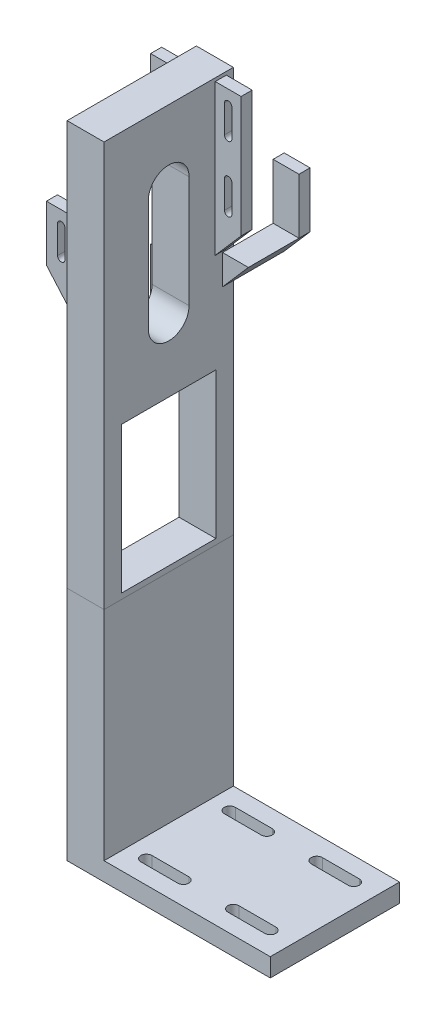
from build123d import *

# Parameters (mm, degrees)
SKETCH1_W               = 20
SKETCH1_H               = 70
SKETCH1_W_2             = 90
BOSS_EXTRUDE1_DEPTH     = 10
SKETCH1_3_W             = 20
SKETCH1_3_H             = 70
BOSS_EXTRUDE2_DEPTH     = 212
BOSS_EXTRUDE3_START     = -20
SKETCH2_W               = 6
SKETCH2_H               = 30
BOSS_EXTRUDE3_DEPTH     = 15
BOSS_EXTRUDE3_2_DEPTH   = 15
BOSS_EXTRUDE3_3_DEPTH   = 15
CUT_EXTRUDE3_DEPTH      = 353.433372815
CUT_EXTRUDE3_DEPTH_BACK = 127.2
SKETCH7_W               = 20
SKETCH7_H               = 70
BOSS_EXTRUDE4_DEPTH     = 135
SKETCH12_W              = 15
SKETCH12_H              = 6
BOSS_EXTRUDE6_DEPTH     = 24.325180813
BOSS_EXTRUDE7_START     = -31.2
BOSS_EXTRUDE7_DEPTH     = 6
BOSS_EXTRUDE8_START     = -31.2
BOSS_EXTRUDE8_DEPTH     = 6
SKETCH3_W               = 51.18180782
SKETCH3_H               = 79.106689165
CUT_EXTRUDE1_DEPTH      = 60
SKETCH17_W              = 6
SKETCH17_H              = 30
BOSS_EXTRUDE9_DEPTH     = 14
CUT_EXTRUDE4_DEPTH      = 14
BOSS_EXTRUDE11_START    = -62.536720157
BOSS_EXTRUDE11_DEPTH    = 33.403488582
SKETCH23_W              = 14
SKETCH23_H              = 6
BOSS_EXTRUDE12_DEPTH    = 28.275172031
SKETCH24_W              = 14
SKETCH24_H              = 6
BOSS_EXTRUDE13_DEPTH    = 5.382525931


with BuildPart() as part:
    # Sketch1 → Boss-Extrude1 (new body)
    # profile 1 of 2: a face of its own
    with BuildSketch(Plane(origin=(0, 0, 0), x_dir=(1, 0, 0), z_dir=(0, 1, 0))):
        with Locations((-33.658940342, 0)):
            Rectangle(SKETCH1_W, SKETCH1_H)
    # profile 2 of 2: a face of its own
    with BuildSketch(Plane(origin=(0, 0, 0), x_dir=(1, 0, 0), z_dir=(0, 1, 0))):
        with Locations((21.341059658, 0)):
            Rectangle(SKETCH1_W_2, SKETCH1_H)
        with BuildLine():
            Line((6.841826819, -25.578170589), (-13.158173181, -25.578170589))
            ThreePointArc((-13.158173181, -25.578170589), (-16.158173181, -22.578170589), (-13.158173181, -19.578170589))
            Line((-13.158173181, -19.578170589), (6.841826819, -19.578170589))
            ThreePointArc((6.841826819, -19.578170589), (9.841826819, -22.578170589), (6.841826819, -25.578170589))
        make_face(mode=Mode.SUBTRACT)
        with BuildLine():
            ThreePointArc((53.940052041, -19.578170589), (56.940052041, -22.578170589), (53.940052041, -25.578170589))
            Line((53.940052041, -25.578170589), (33.940052041, -25.578170589))
            ThreePointArc((33.940052041, -25.578170589), (30.940052041, -22.578170589), (33.940052041, -19.578170589))
            Line((33.940052041, -19.578170589), (53.940052041, -19.578170589))
        make_face(mode=Mode.SUBTRACT)
        with BuildLine():
            ThreePointArc((-13.158173181, 19.578170589), (-16.158173181, 22.578170589), (-13.158173181, 25.578170589))
            Line((-13.158173181, 25.578170589), (6.841826819, 25.578170589))
            ThreePointArc((6.841826819, 25.578170589), (9.841826819, 22.578170589), (6.841826819, 19.578170589))
            Line((6.841826819, 19.578170589), (-13.158173181, 19.578170589))
        make_face(mode=Mode.SUBTRACT)
        with BuildLine():
            Line((33.940052041, 25.578170589), (53.940052041, 25.578170589))
            ThreePointArc((53.940052041, 25.578170589), (56.940052041, 22.578170589), (53.940052041, 19.578170589))
            Line((53.940052041, 19.578170589), (33.940052041, 19.578170589))
            ThreePointArc((33.940052041, 19.578170589), (30.940052041, 22.578170589), (33.940052041, 25.578170589))
        make_face(mode=Mode.SUBTRACT)
    extrude(amount=BOSS_EXTRUDE1_DEPTH)

    # Sketch1<3> → Boss-Extrude2 (add)
    with BuildSketch(Plane(origin=(0, 0, 0), x_dir=(1, 0, 0), z_dir=(0, 1, 0))):
        with Locations((-33.658940342, 0)):
            Rectangle(SKETCH1_3_W, SKETCH1_3_H)
    extrude(amount=BOSS_EXTRUDE2_DEPTH)


with BuildPart() as body_2:
    # Sketch2 → Boss-Extrude3 (new body)
    with BuildSketch(Plane(origin=(-23.658940342, 0, 0), x_dir=(0, 0, -1), z_dir=(1, 0, 0)).offset(BOSS_EXTRUDE3_START)):
        with Locations((-28.2, 284.836255525)):
            Rectangle(SKETCH2_W, SKETCH2_H)
    extrude(amount=-BOSS_EXTRUDE3_DEPTH)


with BuildPart() as body_3:
    # Sketch2 → Boss-Extrude3 2 (new body)
    with BuildSketch(Plane(origin=(-23.658940342, 0, 0), x_dir=(0, 0, -1), z_dir=(1, 0, 0)).offset(BOSS_EXTRUDE3_START)):
        with Locations((28.2, 236.477808494)):
            Rectangle(SKETCH2_W, SKETCH2_H)
    extrude(amount=-BOSS_EXTRUDE3_2_DEPTH)


with BuildPart() as body_4:
    # Sketch2 → Boss-Extrude3 3 (new body)
    with BuildSketch(Plane(origin=(-23.658940342, 0, 0), x_dir=(0, 0, -1), z_dir=(1, 0, 0)).offset(BOSS_EXTRUDE3_START)):
        with Locations((28.2, 325.85789719)):
            Rectangle(SKETCH2_W, SKETCH2_H)
    extrude(amount=-BOSS_EXTRUDE3_3_DEPTH)


with BuildPart() as cut_extrude3_tool:
    # Sketch5 → Cut-Extrude3 (new, two sides: drawn at the far end of the back side and taken through both)
    with BuildSketch(Plane.XY.offset(-25.2).offset(-CUT_EXTRUDE3_DEPTH_BACK)):
        with BuildLine():
            Line((-48.658940342, 292.336255525), (-48.658940342, 277.336255525))
            ThreePointArc((-48.658940342, 277.336255525), (-50.658940342, 275.336255525), (-52.658940342, 277.336255525))
            Line((-52.658940342, 277.336255525), (-52.658940342, 292.336255525))
            ThreePointArc((-52.658940342, 292.336255525), (-50.658940342, 294.336255525), (-48.658940342, 292.336255525))
        make_face()
        with BuildLine():
            Line((-48.658940342, 243.977808494), (-48.658940342, 228.977808494))
            ThreePointArc((-48.658940342, 228.977808494), (-50.658940342, 226.977808494), (-52.658940342, 228.977808494))
            Line((-52.658940342, 228.977808494), (-52.658940342, 243.977808494))
            ThreePointArc((-52.658940342, 243.977808494), (-50.658940342, 245.977808494), (-48.658940342, 243.977808494))
        make_face()
        with BuildLine():
            Line((-48.658940342, 333.35789719), (-48.658940342, 318.35789719))
            ThreePointArc((-48.658940342, 318.35789719), (-50.658940342, 316.35789719), (-52.658940342, 318.35789719))
            Line((-52.658940342, 318.35789719), (-52.658940342, 333.35789719))
            ThreePointArc((-52.658940342, 333.35789719), (-50.658940342, 335.35789719), (-48.658940342, 333.35789719))
        make_face()
    extrude(amount=CUT_EXTRUDE3_DEPTH + CUT_EXTRUDE3_DEPTH_BACK)


with BuildPart() as body_2_1:
    add(body_2.part)

    # Cut-Extrude3: cut by cut_extrude3_tool
    add(cut_extrude3_tool.part, mode=Mode.SUBTRACT)



with BuildPart() as body_3_1:
    add(body_3.part)

    # Cut-Extrude3: cut by cut_extrude3_tool
    add(cut_extrude3_tool.part, mode=Mode.SUBTRACT)


with BuildPart() as body_4_1:
    add(body_4.part)

    # Cut-Extrude3: cut by cut_extrude3_tool
    add(cut_extrude3_tool.part, mode=Mode.SUBTRACT)


with BuildPart() as body_2_2:
    add(body_2_1.part)

    add(body_4_1.part)  # Boss-Extrude4 merges body 4

    add(part.part)  # Boss-Extrude4 merges part
    # Sketch7 → Boss-Extrude4 (add)
    with BuildSketch(Plane(origin=(0, 212, 0), x_dir=(1, 0, 0), z_dir=(0, 1, 0))):
        with Locations((-33.658940342, 0)):
            Rectangle(SKETCH7_W, SKETCH7_H)
    extrude(amount=BOSS_EXTRUDE4_DEPTH)

    # Sketch12 → Boss-Extrude6 (add, along a direction that is not the sketch's normal)
    with BuildSketch(Plane.XZ.offset(-269.836255525)):
        with Locations((-51.158940342, 28.2)):
            Rectangle(SKETCH12_W, SKETCH12_H)
    extrude(amount=BOSS_EXTRUDE6_DEPTH, dir=(0.6560590289905114, -0.7547095802227685, 0))

    # Boss-Extrude7: read off the stored shape, not the designer's step
    # Boss-Extrude7 outline → Boss-Extrude7 (add)
    with BuildSketch(Plane.XY.offset(BOSS_EXTRUDE7_START)):
        Polygon((-58.658940342, 310.85789719), (-43.658940342, 293.602371082), (-43.658940342, 310.85789719), align=None)
    extrude(amount=BOSS_EXTRUDE7_DEPTH)


    add(body_3_1.part)  # Boss-Extrude8 merges body 3
    # Boss-Extrude8: read off the stored shape, not the designer's step
    # Boss-Extrude8 outline → Boss-Extrude8 (add)
    with BuildSketch(Plane.XY.offset(BOSS_EXTRUDE8_START)):
        Polygon((-58.658940342, 221.477808494), (-43.658940342, 204.222282386), (-43.658940342, 221.477808494), align=None)
    extrude(amount=BOSS_EXTRUDE8_DEPTH)

    # Sketch3 → Cut-Extrude1 (cut)
    with BuildSketch(Plane(origin=(-23.658940342, 0, 0), x_dir=(0, 0, -1), z_dir=(1, 0, 0))):
        with Locations((0, 170.315397104)):
            Rectangle(SKETCH3_W, SKETCH3_H)
        with BuildLine():
            Line((11.025757264, 307.676468372), (11.025757264, 247.23954324))
            ThreePointArc((11.025757264, 247.23954324), (0, 236.213785975), (-11.025757264, 247.23954324))
            Line((-11.025757264, 247.23954324), (-11.025757264, 307.676468372))
            ThreePointArc((-11.025757264, 307.676468372), (0, 318.702225636), (11.025757264, 307.676468372))
        make_face()
    extrude(amount=-CUT_EXTRUDE1_DEPTH, mode=Mode.SUBTRACT)

    # Sketch17 → Boss-Extrude9 (add)
    with BuildSketch(Plane(origin=(-23.658940342, 0, 0), x_dir=(0, 0, -1), z_dir=(1, 0, 0))):
        with Locations((28.2, 330.230671493)):
            Rectangle(SKETCH17_W, SKETCH17_H)
        with Locations((28.2, 294.848145562)):
            Rectangle(SKETCH17_W, SKETCH17_H)
        with Locations((59.536720157, 278.109746531)):
            Rectangle(SKETCH17_W, SKETCH17_H)
    extrude(amount=BOSS_EXTRUDE9_DEPTH)


with BuildPart() as boss_extrude9_piece_1:
    # of the separate pieces the step leaves, piece 1, a body of its own (boss_extrude9_pieces)
    add(body_2_2.part.solids().sort_by_distance((-43.658940342, 0, -35))[0])

    # Sketch18 → Cut-Extrude4 (cut)
    with BuildSketch(Plane(origin=(0, 0, -31.2), x_dir=(-1, 0, 0), z_dir=(0, 0, -1))):
        with BuildLine():
            Line((14.658940342, 302.348145562), (14.658940342, 287.348145562))
            ThreePointArc((14.658940342, 287.348145562), (16.658940342, 285.348145562), (18.658940342, 287.348145562))
            Line((18.658940342, 287.348145562), (18.658940342, 302.348145562))
            ThreePointArc((18.658940342, 302.348145562), (16.658940342, 304.348145562), (14.658940342, 302.348145562))
        make_face()
        with BuildLine():
            ThreePointArc((18.658940342, 337.730671493), (16.658940342, 339.730671493), (14.658940342, 337.730671493))
            Line((14.658940342, 337.730671493), (14.658940342, 322.730671493))
            ThreePointArc((14.658940342, 322.730671493), (16.658940342, 320.730671493), (18.658940342, 322.730671493))
            Line((18.658940342, 322.730671493), (18.658940342, 337.730671493))
        make_face()
    extrude(amount=-CUT_EXTRUDE4_DEPTH, mode=Mode.SUBTRACT)


with BuildPart() as boss_extrude9_piece_2:
    # of the separate pieces the step leaves, piece 2, a body of its own (boss_extrude9_pieces)
    add(body_2_2.part.solids().sort_by_distance((-23.658940342, 293.109746531, -56.536720157))[0])


with BuildPart() as body_3_2:
    # Intersect1: read off the stored shape, not the designer's step
    # Intersect1: the piece on the far side of the plane
    add(boss_extrude9_piece_1.part)
    split(bisect_by=Plane(origin=(0, 127.762052521, 0), x_dir=(1, 0, 0), z_dir=(0, 1, 0)), keep=Keep.BOTTOM)


with BuildPart() as boss_extrude9_piece_1_1:
    add(boss_extrude9_piece_1.part)

    # Intersect1
    split(bisect_by=Plane(origin=(0, 127.762052521, 0), x_dir=(1, 0, 0), z_dir=(0, 1, 0)), keep=Keep.TOP)

    # Boss-Extrude11: read off the stored shape, not the designer's step
    # Boss-Extrude11 outline → Boss-Extrude11 (add)
    with BuildSketch(Plane.XY.offset(BOSS_EXTRUDE11_START)):
        Polygon((-9.658940342, 263.109746531), (-23.658940342, 263.109746531), (-23.658940342, 247.00458883), align=None)
    extrude(amount=BOSS_EXTRUDE11_DEPTH)

    # Sketch23 → Boss-Extrude12 (add, along a direction that is not the sketch's normal)
    with BuildSketch(Plane.XZ.offset(-279.848145562)):
        with Locations((-16.658940342, -28.2)):
            Rectangle(SKETCH23_W, SKETCH23_H)
    extrude(amount=BOSS_EXTRUDE12_DEPTH, dir=(-0.6560590289905113, -0.7547095802227686, 0))

    # Sketch24 → Boss-Extrude13 (add)
    with BuildSketch(Plane.XZ.offset(-315.230671493)):
        with Locations((-16.658940342, -28.2)):
            Rectangle(SKETCH24_W, SKETCH24_H)
    extrude(amount=BOSS_EXTRUDE13_DEPTH)


solid = Compound([boss_extrude9_piece_2.part, body_3_2.part, boss_extrude9_piece_1_1.part])
